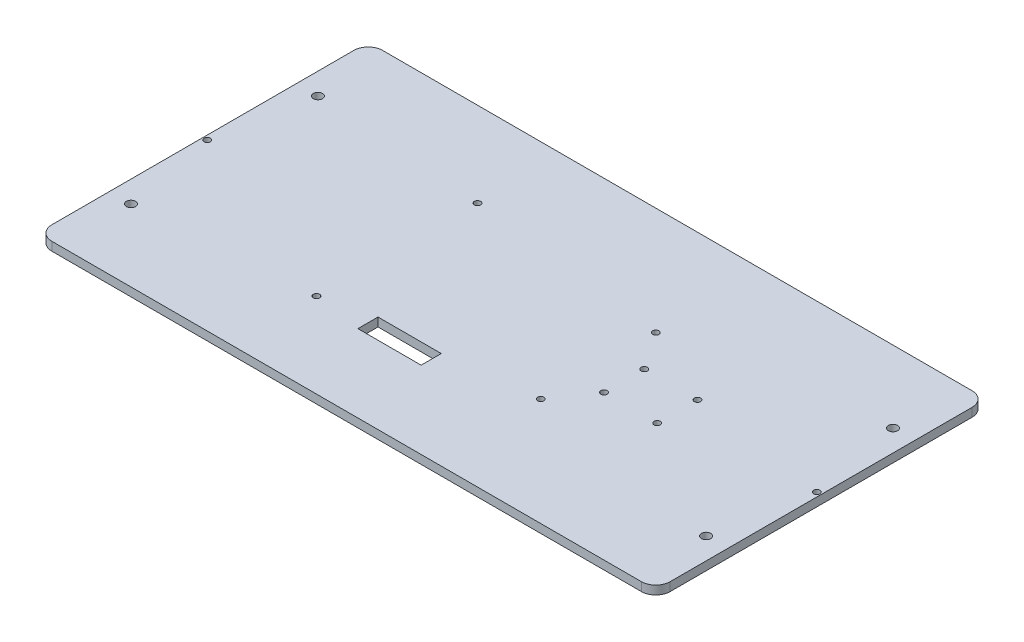
from build123d import *

# Parameters (mm, degrees)
SKETCH1_W           = 215
SKETCH1_H           = 115
SKETCH1_R           = 1.1
SKETCH1_R_2         = 1.6
SKETCH1_W_2         = 22
SKETCH1_H_2         = 7
BOSS_EXTRUDE1_DEPTH = 3
FILLET1_R           = 5


with BuildPart() as part:
    # Sketch1 → Boss-Extrude1 (new body)
    with BuildSketch(Plane(origin=(0, 0, 0), x_dir=(1, 0, 0), z_dir=(0, 1, 0))):
        Rectangle(SKETCH1_W, SKETCH1_H)
        with Locations((-40, 28)):
            Circle(SKETCH1_R, mode=Mode.SUBTRACT)
        with Locations((30, 20)):
            Circle(SKETCH1_R, mode=Mode.SUBTRACT)
        with Locations((-40, -28)):
            Circle(SKETCH1_R, mode=Mode.SUBTRACT)
        with Locations((30, -20)):
            Circle(SKETCH1_R, mode=Mode.SUBTRACT)
        with Locations((-100, 32.5)):
            Circle(SKETCH1_R_2, mode=Mode.SUBTRACT)
        with Locations((100, 32.5)):
            Circle(SKETCH1_R_2, mode=Mode.SUBTRACT)
        with Locations((100, -32.5)):
            Circle(SKETCH1_R_2, mode=Mode.SUBTRACT)
        with Locations((-100, -32.5)):
            Circle(SKETCH1_R_2, mode=Mode.SUBTRACT)
        with Locations((-106, 0)):
            Circle(SKETCH1_R, mode=Mode.SUBTRACT)
        with Locations((106, 0)):
            Circle(SKETCH1_R, mode=Mode.SUBTRACT)
        with Locations((39, 7)):
            Circle(SKETCH1_R, mode=Mode.SUBTRACT)
        with Locations((57.5, 7)):
            Circle(SKETCH1_R, mode=Mode.SUBTRACT)
        with Locations((57.5, -7)):
            Circle(SKETCH1_R, mode=Mode.SUBTRACT)
        with Locations((39, -7)):
            Circle(SKETCH1_R, mode=Mode.SUBTRACT)
        with Locations((-12, -27.1)):
            Rectangle(SKETCH1_W_2, SKETCH1_H_2, mode=Mode.SUBTRACT)
    extrude(amount=BOSS_EXTRUDE1_DEPTH)

    # Fillet1
    fillet1_edges = [part.edges().sort_by_distance(p)[0] for p in [
        (-107.5, 1.5, -57.5),
        (107.5, 1.5, -57.5),
        (107.5, 1.5, 57.5),
        (-107.5, 1.5, 57.5),
    ]]
    fillet(fillet1_edges, radius=FILLET1_R)


solid = part.part
